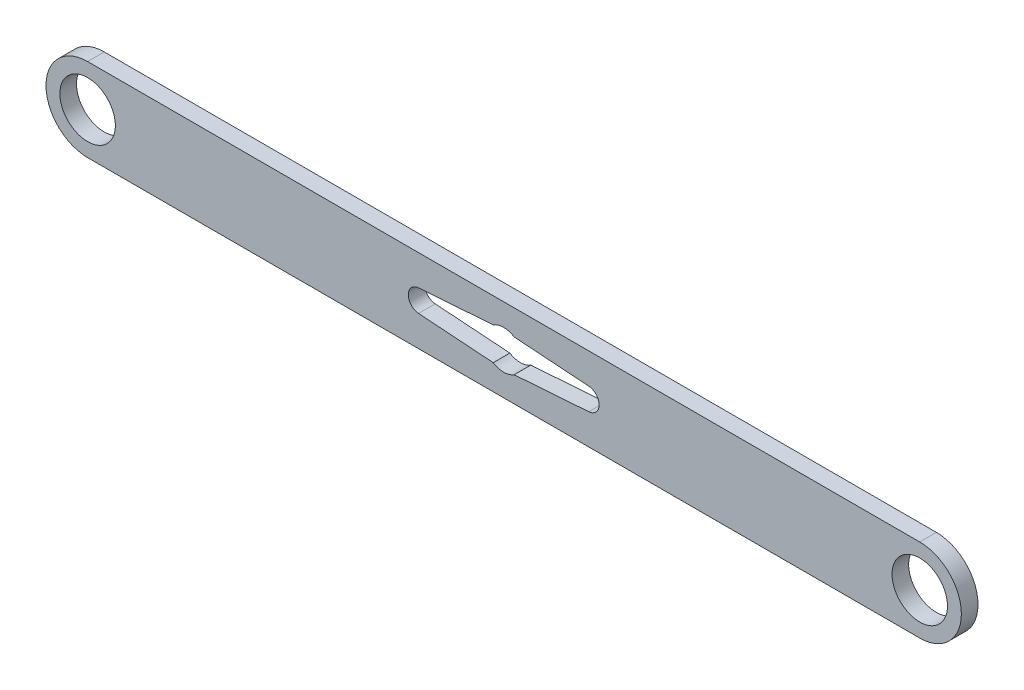
from build123d import *

# Parameters (mm, degrees)
SKETCH1_R           = 5
BOSS_EXTRUDE1_DEPTH = 3


with BuildPart() as part:
    # Sketch1 → Boss-Extrude1 (new body)
    with BuildSketch(Plane.XY):
        with BuildLine():
            Line((75, -7.5), (-75, -7.5))
            ThreePointArc((-75, -7.5), (-82.5, 0), (-75, 7.5))
            Line((-75, 7.5), (75, 7.5))
            ThreePointArc((75, 7.5), (82.5, 0), (75, -7.5))
        make_face()
        with Locations((75, 0)):
            Circle(SKETCH1_R, mode=Mode.SUBTRACT)
        with Locations((-75, 0)):
            Circle(SKETCH1_R, mode=Mode.SUBTRACT)
        with BuildLine():
            Line((-1.88348082, 2.95), (-15.34156858, 1.994983292))
            ThreePointArc((-15.34156858, 1.994983292), (-17.2, 0), (-15.34156858, -1.994983292))
            Line((-15.34156858, -1.994983292), (-1.88348082, -2.95))
            ThreePointArc((-1.88348082, -2.95), (0, -3.5), (1.88348082, -2.95))
            Line((1.88348082, -2.95), (15.34156858, -1.994983292))
            ThreePointArc((15.34156858, -1.994983292), (17.2, 0), (15.34156858, 1.994983292))
            Line((15.34156858, 1.994983292), (1.88348082, 2.95))
            ThreePointArc((1.88348082, 2.95), (0, 3.5), (-1.88348082, 2.95))
        make_face(mode=Mode.SUBTRACT)
    extrude(amount=BOSS_EXTRUDE1_DEPTH)


solid = part.part
